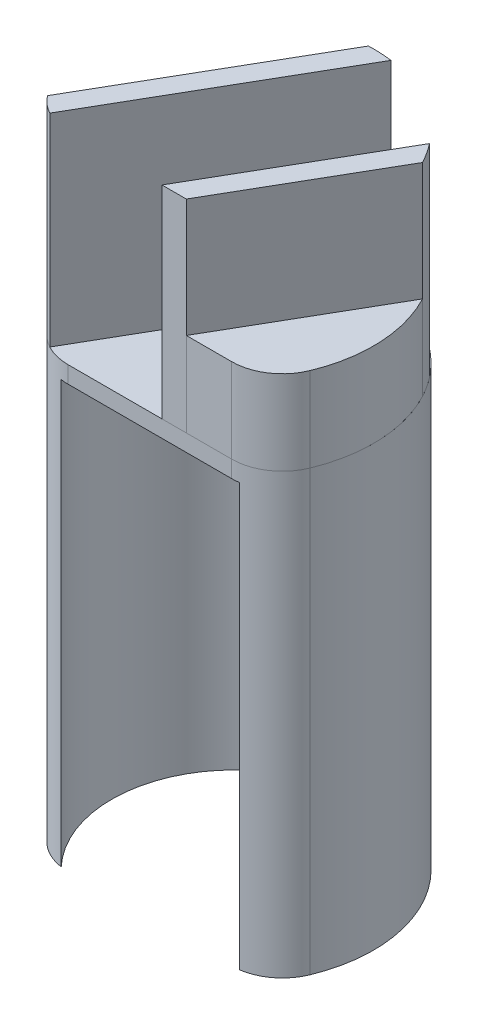
from build123d import *

# Parameters (mm, degrees)
SKETCH_1_R          = 16.5
SKETCH_1_R_2        = 14.5
EXTRUDE_1_DEPTH     = 35
SKETCH_3_R          = 16.5
EXTRUDE_2_DEPTH     = 2
SKETCH_4_W          = 78.350079852
SKETCH_4_H          = 91.802514566
CUT_EXTRUDE_1_DEPTH = 49.40970977
CUT_EXTRUDE_2_REACH = 45.744
SKETCH_5_R          = 3.75
FILLET_1_R          = 6
EXTRUDE_3_DEPTH     = 24
EXTRUDE_3_2_DEPTH   = 24
EXTRUDE_7_DEPTH     = 10
EXTRUDE_START       = 15
EXTRUDE_8_DEPTH     = 15


with BuildPart() as part:
    # 草图1 → 凸台-拉伸1 (new body)
    with BuildSketch(Plane(origin=(0, 0, 0), x_dir=(1, 0, 0), z_dir=(0, 1, 0))):
        Circle(SKETCH_1_R)
        Circle(SKETCH_1_R_2, mode=Mode.SUBTRACT)
    extrude(amount=EXTRUDE_1_DEPTH)

    # 草图3 → 凸台-拉伸2 (add)
    with BuildSketch(Plane(origin=(0, 35, 0), x_dir=(1, 0, 0), z_dir=(0, 1, 0))):
        Circle(SKETCH_3_R)
    extrude(amount=EXTRUDE_2_DEPTH)

    # 草图4 → 切除-拉伸1 (cut, through all)
    with BuildSketch(Plane.XY.offset(10)):
        with Locations((-10.760491613, -6.179419868)):
            Rectangle(SKETCH_4_W, SKETCH_4_H)
    extrude(amount=CUT_EXTRUDE_1_DEPTH, mode=Mode.SUBTRACT)

    # 草图5 → 切除-拉伸2 (cut, up to next)
    with BuildSketch(Plane(origin=(0, 37, 0), x_dir=(1, 0, 0), z_dir=(0, 1, 0)), mode=Mode.PRIVATE) as cut_extrude_2_sk1:
        Circle(SKETCH_5_R)
    cut_extrude_2_tool1 = extrude(cut_extrude_2_sk1.sketch, amount=-CUT_EXTRUDE_2_REACH, mode=Mode.PRIVATE) & part.part
    add(cut_extrude_2_tool1.solids().sort_by_distance((0, 37, 0))[0], mode=Mode.SUBTRACT)

    # 圆角1
    fillet_1_edges = [part.edges().sort_by_distance(p)[0] for p in [
        (-13.124404748, 18.5, 10),
        (13.124404748, 18.5, 10),
    ]]
    fillet(fillet_1_edges, radius=FILLET_1_R)

    # 草图10 → 凸台-拉伸8 (add)
    with BuildSketch(Plane.XZ.offset(EXTRUDE_START)):
        with BuildLine():
            ThreePointArc((-15.255811873, 6.285714286), (0, -16.5), (15.255811873, 6.285714286))
            ThreePointArc((15.255811873, 6.285714286), (13.391521243, 8.736398226), (10.557154474, 9.939642318))
            ThreePointArc((10.557154474, 9.939642318), (0, -14.5), (-10.557154474, 9.939642318))
            ThreePointArc((-10.557154474, 9.939642318), (-13.391521243, 8.736398226), (-15.255811873, 6.285714286))
        make_face()
    extrude(amount=-EXTRUDE_8_DEPTH)


with BuildPart() as body_2:
    # 草图6 → 凸台-拉伸3 (new body)
    with BuildSketch(Plane(origin=(0, 37, 0), x_dir=(1, 0, 0), z_dir=(0, 1, 0))):
        with BuildLine():
            Line((13.047897801, 10.099621923), (1.443375673, -10))
            Line((1.443375673, -10), (4.330127019, -10))
            Line((4.330127019, -10), (14.5721397, 7.739686335))
            ThreePointArc((14.5721397, 7.739686335), (13.860337004, 8.952153826), (13.047897801, 10.099621923))
        make_face()
    extrude(amount=EXTRUDE_3_DEPTH)


with BuildPart() as body_3:
    # 草图6 → Extrude 3 2 (new body)
    with BuildSketch(Plane(origin=(0, 37, 0), x_dir=(1, 0, 0), z_dir=(0, 1, 0))):
        with BuildLine():
            Line((-0.583304866, 16.489686335), (-14.498767089, -7.612601246))
            ThreePointArc((-14.498767089, -7.612601246), (-13.623792058, -8.546260307), (-12.570735662, -9.273152854))
            Line((-12.570735662, -9.273152854), (2.222580253, 16.349621923))
            ThreePointArc((2.222580253, 16.349621923), (0.82262413, 16.479480864), (-0.583304866, 16.489686335))
        make_face()
    extrude(amount=EXTRUDE_3_2_DEPTH)


with BuildPart() as body_4:
    # 草图9 → 凸台-拉伸7 (new body)
    with BuildSketch(Plane(origin=(0, 37, 0), x_dir=(1, 0, 0), z_dir=(0, 1, 0))):
        with BuildLine():
            Line((4.330127019, -10), (9.708243919, -10))
            ThreePointArc((9.708243919, -10), (13.046335761, -8.985693819), (15.255811873, -6.285714286))
            ThreePointArc((15.255811873, -6.285714286), (16.480432015, 0.803343383), (14.5721397, 7.739686335))
            Line((14.5721397, 7.739686335), (4.330127019, -10))
        make_face()
    extrude(amount=EXTRUDE_7_DEPTH)


solid = Compound([part.part, body_2.part, body_3.part, body_4.part])
